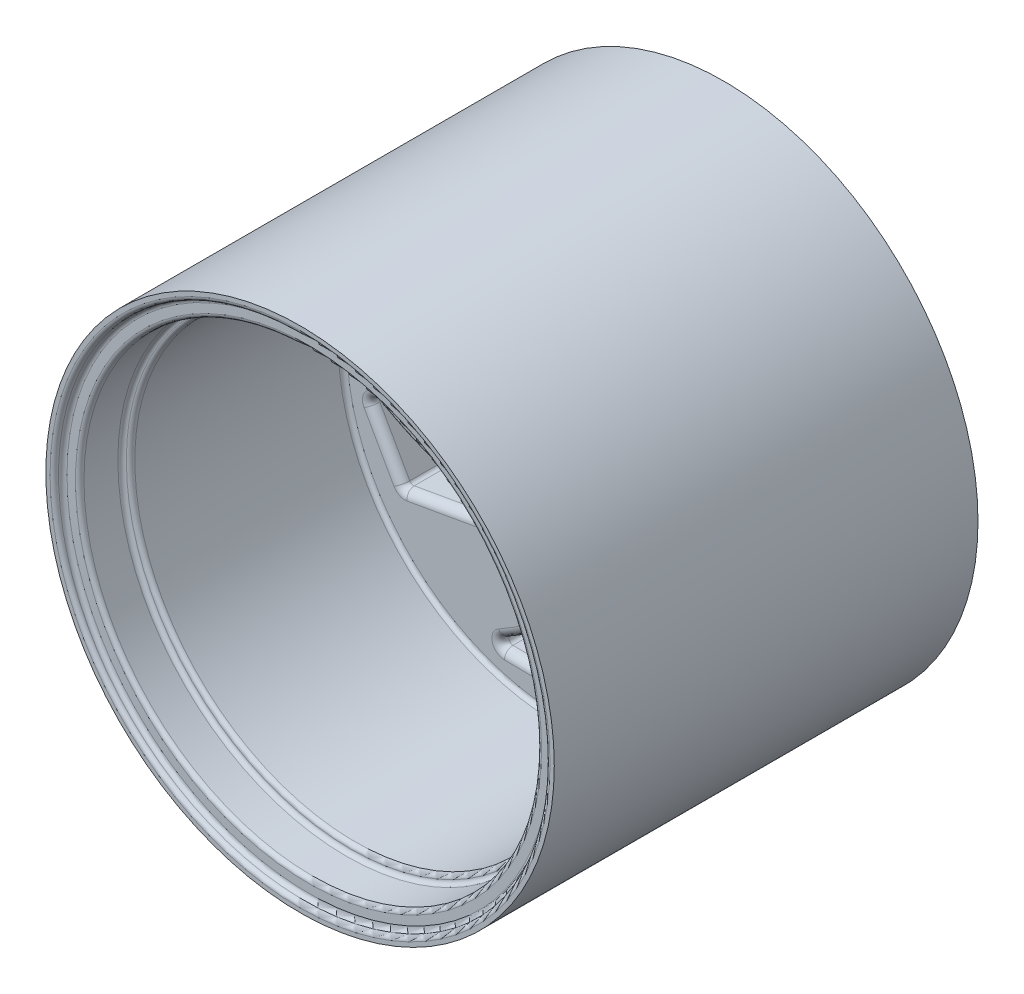
from build123d import *

# Parameters (mm, degrees)
IZIM1_R                     = 30
Y_KSEKLIK_EKSTR_ZYON1_DEPTH = 50
IZIM2_R                     = 29
KES_EKSTR_ZYON1_DEPTH       = 1
KES_EKSTR_ZYON2_START       = -1
IZIM3_R                     = 29
KES_EKSTR_ZYON2_DEPTH       = 1
IZIM4_R                     = 27
KES_EKSTR_ZYON3_DEPTH       = 5
IZIM5_R                     = 26
KES_EKSTR_ZYON4_DEPTH       = 25
IZIM6_R                     = 10
IZIM6_R_2                   = 8
IZIM6_R_3                   = 1
Y_KSEKLIK_EKSTR_ZYON2_DEPTH = 2
IZIM8_R                     = 2
KES_EKSTR_ZYON5_DEPTH       = 59.412250759
KES_EKSTR_ZYON6_DEPTH       = 59.412250759
IZIM12_R                    = 29
KES_EKSTR_ZYON7_DEPTH       = 10
Y_KSEKLIK_EKSTR_ZYON4_START = 10
Y_KSEKLIK_EKSTR_ZYON4_DEPTH = 10
RADYUS1_R                   = 0.5
RADYUS5_R                   = 0.5
RADYUS6_R                   = 1
RADYUS7_R                   = 0.5
SKETCH1_R                   = 2
BOSS_EXTRUDE1_DEPTH         = 2


# Some blends are built 0.0001 mm under size
with BuildPart() as part:
    # Çizim1 → Yükseklik-Ekstrüzyon1 (new body)
    with BuildSketch(Plane.XY):
        with Locations((-8.148787303, -1.554097453)):
            Circle(IZIM1_R)
    extrude(amount=Y_KSEKLIK_EKSTR_ZYON1_DEPTH)

    # Çizim2 → Kes-Ekstrüzyon1 (cut)
    with BuildSketch(Plane(origin=(0, 0, 0), x_dir=(-1, 0, 0), z_dir=(0, 0, -1))):
        with Locations((8.148787303, -1.554097453)):
            Circle(IZIM2_R)
    extrude(amount=-KES_EKSTR_ZYON1_DEPTH, mode=Mode.SUBTRACT)

    # Çizim3 → Kes-Ekstrüzyon2 (cut)
    with BuildSketch(Plane.XY.offset(50).offset(KES_EKSTR_ZYON2_START)):
        with Locations(Location((-8.148787303, -1.554097453, 0), (0, 0, 180))):
            Circle(IZIM3_R)
    extrude(amount=KES_EKSTR_ZYON2_DEPTH, mode=Mode.SUBTRACT)

    # Çizim4 → Kes-Ekstrüzyon3 (cut)
    with BuildSketch(Plane.XY.offset(49)):
        with Locations((-8.148787303, -1.554097453)):
            Circle(IZIM4_R)
    extrude(amount=-KES_EKSTR_ZYON3_DEPTH, mode=Mode.SUBTRACT)

    # Çizim5 → Kes-Ekstrüzyon4 (cut)
    with BuildSketch(Plane.XY.offset(44)):
        with Locations((-8.148787303, -1.554097453)):
            Circle(IZIM5_R)
    extrude(amount=-KES_EKSTR_ZYON4_DEPTH, mode=Mode.SUBTRACT)

    # Çizim6 → Yükseklik-Ekstrüzyon2 (add)
    # profile 1 of 9: a face of its own
    with BuildSketch(Plane.XY.offset(19)):
        with Locations((-8.148787303, -1.554097453)):
            Circle(IZIM6_R)
        with Locations((-8.148787303, -1.554097453)):
            Circle(IZIM6_R_2, mode=Mode.SUBTRACT)
    # profile 2 of 9: a face of its own
    with BuildSketch(Plane.XY.offset(19)):
        with Locations((-8.148787303, 4.445902547)):
            Circle(IZIM6_R_3)
    # profile 3 of 9: a face of its own
    with BuildSketch(Plane.XY.offset(19)):
        with Locations((-14.148787303, -1.554097453)):
            Circle(IZIM6_R_3)
    # profile 4 of 9: a face of its own
    with BuildSketch(Plane.XY.offset(19)):
        with Locations((-12.39142799, -5.79673814)):
            Circle(IZIM6_R_3)
    # profile 5 of 9: a face of its own
    with BuildSketch(Plane.XY.offset(19)):
        with Locations((-8.148787303, -7.554097453)):
            Circle(IZIM6_R_3)
    # profile 6 of 9: a face of its own
    with BuildSketch(Plane.XY.offset(19)):
        with Locations((-3.906146615, -5.79673814)):
            Circle(IZIM6_R_3)
    # profile 7 of 9: a face of its own
    with BuildSketch(Plane.XY.offset(19)):
        with Locations((-3.906146615, 2.688543234)):
            Circle(IZIM6_R_3)
    # profile 8 of 9: a face of its own
    with BuildSketch(Plane.XY.offset(19)):
        with Locations((-12.39142799, 2.688543234)):
            Circle(IZIM6_R_3)
    # profile 9 of 9: a face of its own
    with BuildSketch(Plane.XY.offset(19)):
        with Locations((-2.148787303, -1.554097453)):
            Circle(IZIM6_R_3)
    extrude(amount=Y_KSEKLIK_EKSTR_ZYON2_DEPTH)

    # Çizim8 → Kes-Ekstrüzyon5 (cut, through all)
    with BuildSketch(Plane.XY.offset(19)):
        with Locations((-8.148787303, -1.554097453)):
            Circle(IZIM8_R)
    extrude(amount=-KES_EKSTR_ZYON5_DEPTH, mode=Mode.SUBTRACT)

    # Çizim9 → Kes-Ekstrüzyon6 (cut, through all)
    with BuildSketch(Plane.XY.offset(19)):
        with BuildLine():
            Line((-13.925732405, 6.608433116), (-8.833557811, 20.638443128))
            Line((-8.833557811, 20.638443128), (0.723069615, 20.525490043))
            add(Edge.make_bspline(
                [(0.723069615, 20.525490043), (-8.727629056, 15.967451289), (-13.925732405, 6.608433116)],
                knots=[0, 0, 0, 1, 1, 1], degree=2))
        make_face()
        with BuildLine():
            Line((-3.968301022, 7.530149046), (10.72813136, 10.135201494))
            Line((10.72813136, 10.135201494), (15.408624833, 1.802442826))
            add(Edge.make_bspline(
                [(15.408624833, 1.802442826), (6.735898145, 7.707968582), (-3.968301022, 7.530149046)],
                knots=[0, 0, 0, 1, 1, 1], degree=2))
        make_face()
        with BuildLine():
            Line((1.80864408, -0.632381522), (11.412901869, -12.057339087))
            Line((11.412901869, -12.057339087), (6.536767916, -20.277144671))
            add(Edge.make_bspline(
                [(6.536767916, -20.277144671), (7.314739899, -9.813580161), (1.80864408, -0.632381522)],
                knots=[0, 0, 0, 1, 1, 1], degree=2))
        make_face()
        with BuildLine():
            Line((-2.3718422, -9.716628021), (-7.464016794, -23.746638033))
            Line((-7.464016794, -23.746638033), (-17.02064422, -23.633684949))
            add(Edge.make_bspline(
                [(-17.02064422, -23.633684949), (-7.569945549, -19.075646195), (-2.3718422, -9.716628021)],
                knots=[0, 0, 0, 1, 1, 1], degree=2))
        make_face()
        with BuildLine():
            Line((-12.329273583, -10.638343952), (-27.025705965, -13.243396399))
            Line((-27.025705965, -13.243396399), (-31.706199438, -4.910637732))
            add(Edge.make_bspline(
                [(-31.706199438, -4.910637732), (-23.03347275, -10.816163487), (-12.329273583, -10.638343952)],
                knots=[0, 0, 0, 1, 1, 1], degree=2))
        make_face()
        with BuildLine():
            Line((-18.106218685, -2.475813384), (-27.710476474, 8.949144181))
            Line((-27.710476474, 8.949144181), (-22.834342521, 17.168949765))
            add(Edge.make_bspline(
                [(-22.834342521, 17.168949765), (-23.612314504, 6.705385255), (-18.106218685, -2.475813384)],
                knots=[0, 0, 0, 1, 1, 1], degree=2))
        make_face()
    extrude(amount=-KES_EKSTR_ZYON6_DEPTH, mode=Mode.SUBTRACT)

    # Çizim12 → Kes-Ekstrüzyon7 (cut)
    with BuildSketch(Plane(origin=(0, 0, 1), x_dir=(-1, 0, 0), z_dir=(0, 0, -1))):
        with Locations((8.148787303, -1.554097453)):
            Circle(IZIM12_R)
    extrude(amount=-KES_EKSTR_ZYON7_DEPTH, mode=Mode.SUBTRACT)

    # Çizim13 → Yükseklik-Ekstrüzyon4 (add)
    with BuildSketch(Plane(origin=(0, 0, 11), x_dir=(-1, 0, 0), z_dir=(0, 0, -1)).offset(Y_KSEKLIK_EKSTR_ZYON4_START)):
        with BuildLine():
            Line((25.695028079, 21.53686796), (26.090507249, 21.230932957))
            Line((26.090507249, 21.230932957), (13.239027353, 4.617568143))
            ThreePointArc((13.239027353, 4.617568143), (15.55174657, 1.478425274), (16.105928887, -2.381078591))
            Line((16.105928887, -2.381078591), (36.919270337, -5.204105))
            Line((36.919270337, -5.204105), (36.852062437, -5.699567509))
            Line((36.852062437, -5.699567509), (16.038726518, -2.87654185))
            ThreePointArc((16.038726518, -2.87654185), (14.476508655, -6.448986878), (11.411171421, -8.858674776))
            Line((11.411171421, -8.858674776), (19.37302956, -28.295070413))
            Line((19.37302956, -28.295070413), (18.91034249, -28.484597919))
            Line((18.91034249, -28.484597919), (10.948486467, -9.048207446))
            ThreePointArc((10.948486467, -9.048207446), (7.073549388, -9.481509605), (3.454029836, -8.031693638))
            Line((3.454029836, -8.031693638), (-9.397453474, -24.645062866))
            Line((-9.397453474, -24.645062866), (-9.792932644, -24.339127863))
            Line((-9.792932644, -24.339127863), (3.058547252, -7.725763049))
            ThreePointArc((3.058547252, -7.725763049), (0.745828035, -4.58662018), (0.191645718, -0.727116315))
            Line((0.191645718, -0.727116315), (-20.621695731, 2.095910094))
            Line((-20.621695731, 2.095910094), (-20.554487832, 2.591372603))
            Line((-20.554487832, 2.591372603), (0.258848088, -0.231653055))
            ThreePointArc((0.258848088, -0.231653055), (1.82106595, 3.340791972), (4.886403184, 5.75047987))
            Line((4.886403184, 5.75047987), (-3.075454955, 25.186875507))
            Line((-3.075454955, 25.186875507), (-2.612767885, 25.376403013))
            Line((-2.612767885, 25.376403013), (5.349088138, 5.94001254))
            ThreePointArc((5.349088138, 5.94001254), (9.224025217, 6.373314699), (12.843544769, 4.923498732))
            Line((12.843544769, 4.923498732), (25.695028079, 21.53686796))
        make_face()
        Polygon((13.35894405, -5.185570983), (13.898814007, 1.142293883), (8.688657259, 4.773767413), (2.938630555, 2.077376077), (2.398760599, -4.250488789), (7.608917346, -7.881962319), align=None, mode=Mode.SUBTRACT)
    extrude(amount=-Y_KSEKLIK_EKSTR_ZYON4_DEPTH)

    # Radyus1
    radyus1_edges = [part.edges().sort_by_distance(p)[0] for p in [
        (20.851212697, -1.554097453, 49),
        (20.851212697, -1.554097453, 50),
        (-35.148787303, -1.554097453, 44),
        (-35.148787303, -1.554097453, 49),
        (-34.148787303, -1.554097453, 19),
        (-34.148787303, -1.554097453, 44),
    ]]
    fillet(radyus1_edges, radius=RADYUS1_R - 0.0001)  # a hair under: the kernel refuses the full size

    # Radyus5
    # the kernel refuses this fillet: 0.5 mm, written as the material it adds along each edge
    with BuildSketch(Plane(origin=(-22.834342521, 17.168949765, 19), x_dir=(-0.045917830144074794, -0.9989452201571715, 0), z_dir=(0, 0, -1)), Plane(origin=(-31.706199438, -4.910637732, 19), x_dir=(0.8421530225731109, -0.5392386174700152, 0), z_dir=(0, 0, -1)), Plane(origin=(-17.02064422, -23.633684949, 19), x_dir=(0.888070852717188, 0.459706602687156, 0), z_dir=(0, 0, -1)), Plane(origin=(6.536767916, -20.277144671, 19), x_dir=(0.045917830144079165, 0.9989452201571712, 0), z_dir=(0, 0, -1)), Plane(origin=(15.408624833, 1.802442826, 19), x_dir=(-0.8421530225731088, 0.5392386174700184, 0), z_dir=(0, 0, -1)), Plane(origin=(0.723069615, 20.525490043, 19), x_dir=(-0.8880708527171902, -0.45970660268715174, 0), z_dir=(0, 0, -1))) as radyus5_piece_1:
        with BuildLine():
            CenterArc((2.001629054, 0.499794242), RADYUS5_R, 118.04534383, 150.310869402)
            Line((1.766543964, 0.941082131), (1.761842262, 0.949907889))
            Line((1.761842262, 0.949907889), (-0.004701702, 0.008825758))
            Line((-0.004701702, 0.008825758), (0.000282763, -0.009996001))
            ThreePointArc((0.000282763, -0.009996001), (0.993642712, 0.00415476), (1.98699942, -0.009995885))
            Line((1.98699942, -0.009995885), (1.987286276, 0))
        make_face()
    extrude(amount=8)
    with BuildSketch(Plane(origin=(-18.106218685, -2.475813384, 19), x_dir=(-0.4605887665447725, 0.8876136480095184, 0), z_dir=(0, 0, -1)), Plane(origin=(-12.329273583, -10.638343952, 19), x_dir=(-0.998990351194408, 0.04492525147924159, 0), z_dir=(0, 0, -1)), Plane(origin=(-2.3718422, -9.716628021, 19), x_dir=(-0.5384015846496285, -0.8426883965302768, 0), z_dir=(0, 0, -1)), Plane(origin=(1.80864408, -0.632381522, 19), x_dir=(0.46058876654478326, -0.8876136480095126, 0), z_dir=(0, 0, -1)), Plane(origin=(-3.968301022, 7.530149046, 19), x_dir=(0.9989903511944087, -0.044925251479229544, 0), z_dir=(0, 0, -1)), Plane(origin=(-13.925732405, 6.608433116, 19), x_dir=(0.5384015846496182, 0.8426883965302833, 0), z_dir=(0, 0, -1))) as radyus5_piece_2:
        with BuildLine():
            CenterArc((4.514789372, -0.498983263), RADYUS5_R, 93.654521519, 163.718887163)
            Line((4.405491299, -0.986890971), (4.403305337, -0.996649125))
            Line((4.403305337, -0.996649125), (-0.002185961, -0.009758154))
            Line((-0.002185961, -0.009758154), (0.000615121, 0.009981063))
            ThreePointArc((0.000615121, 0.009981063), (2.241425805, -0.060297124), (4.482281874, 0.009979665))
            Line((4.482281874, 0.009979665), (4.482919275, 0))
        make_face()
    extrude(amount=8)
    with BuildSketch(Plane(origin=(-27.710476474, 8.949144181, 19), x_dir=(0.6434785417464973, -0.7654641508991792, 0), z_dir=(0, 0, -1)), Plane(origin=(-27.025705965, -13.243396399, 19), x_dir=(0.984650671238221, 0.17453668849305284, 0), z_dir=(0, 0, -1)), Plane(origin=(-7.464016794, -23.746638033, 19), x_dir=(0.34117212949171294, 0.9400008393922262, 0), z_dir=(0, 0, -1)), Plane(origin=(11.412901869, -12.057339087, 19), x_dir=(-0.6434785417465096, 0.7654641508991689, 0), z_dir=(0, 0, -1)), Plane(origin=(10.72813136, 10.135201494, 19), x_dir=(-0.9846506712382194, -0.17453668849306167, 0), z_dir=(0, 0, -1)), Plane(origin=(-8.833557811, 20.638443128, 19), x_dir=(-0.3411721294917053, -0.9400008393922289, 0), z_dir=(0, 0, -1))) as radyus5_piece_3:
        with BuildLine():
            CenterArc((RADYUS5_R * 0.70972912952, -RADYUS5_R), RADYUS5_R, 90, 70.728864475)
            Line((-RADYUS5_R * 0.234238208874, -RADYUS5_R * 0.669961117373), (-RADYUS5_R * 0.253117555642, -RADYUS5_R * 0.663360339721))
            Line((-RADYUS5_R * 0.253117555642, -RADYUS5_R * 0.663360339721), (-RADYUS5_R * 0.0141945825904, RADYUS5_R * 0.02))
            Line((-RADYUS5_R * 0.0141945825904, RADYUS5_R * 0.02), (RADYUS5_R * 0.70972912952, RADYUS5_R * 0.02))
            Line((RADYUS5_R * 0.70972912952, RADYUS5_R * 0.02), (RADYUS5_R * 0.70972912952, 0))
        make_face()
    extrude(amount=8)

    # Radyus6
    radyus6_edges = [part.edges().sort_by_distance(p)[0] for p in [
        (-25.692486189, 12.350914512, 19),
        (-22.298959889, 8.192351844, 19),
        (-24.246722562, 4.828759001, 19),
        (-23.664546284, -8.935281732, 19),
        (-21.725470771, -12.303890109, 19),
        (-28.962730347, -9.794880383, 19),
        (-11.419031461, -23.699892348, 19),
        (-9.514373698, -18.681731029, 19),
        (-5.627535511, -18.686746564, 19),
        (9.394911584, -15.459109418, 19),
        (6.001385284, -11.30054675, 19),
        (7.949147957, -7.936953907, 19),
        (7.366971679, 5.827086826, 19),
        (5.427896165, 9.195695204, 19),
        (12.665155742, 6.686685477, 19),
        (-4.878543145, 20.591697442, 19),
        (-6.783200908, 15.573536124, 19),
        (-10.670039095, 15.578551658, 19),
        (-23.289106196, 15.67341291, 19),
        (-20.364282606, 0.877314736, 19),
        (-27.597724453, 8.958388855, 19),
        (-16.362199677, -10.917320611, 19),
        (-26.977336077, -13.141127948, 19),
        (-30.638408368, -6.052243055, 19),
        (-15.498089474, -23.279753418, 19),
        (-4.146704373, -13.3487328, 19),
        (-7.528398927, -23.653614256, 19),
        (6.991531591, -18.781607816, 19),
        (4.066708001, -3.985509642, 19),
        (11.300149848, -12.066583761, 19),
        (0.064625072, 7.809125705, 19),
        (14.340833763, 2.944048149, 19),
        (10.679761472, 10.032933042, 19),
        (-0.799485131, 20.171558512, 19),
        (-12.150870232, 10.240537894, 19),
        (-8.769175678, 20.54541935, 19),
    ]]
    fillet(radyus6_edges, radius=RADYUS6_R)

    # Radyus7
    radyus7_edges = [part.edges().sort_by_distance(p)[0] for p in [
        (-18.148787303, -1.554097453, 19),
        (-16.148787303, -1.554097453, 19),
        (-16.148787303, -1.554097453, 21),
        (-18.148787303, -1.554097453, 21),
        (-9.148787303, 4.445902547, 19),
        (-9.148787303, 4.445902547, 21),
        (-15.148787303, -1.554097453, 19),
        (-15.148787303, -1.554097453, 21),
        (-13.39142799, -5.79673814, 19),
        (-13.39142799, -5.79673814, 21),
        (-9.148787303, -7.554097453, 19),
        (-9.148787303, -7.554097453, 21),
        (-4.906146615, -5.79673814, 19),
        (-4.906146615, -5.79673814, 21),
        (-4.906146615, 2.688543234, 19),
        (-4.906146615, 2.688543234, 21),
        (-13.39142799, 2.688543234, 19),
        (-13.39142799, 2.688543234, 21),
        (-3.148787303, -1.554097453, 19),
        (-3.148787303, -1.554097453, 21),
    ]]
    fillet(radyus7_edges, radius=RADYUS7_R - 0.0001)  # a hair under: the kernel refuses the full size

    # Sketch1 → Boss-Extrude1 (add)
    with BuildSketch(Plane(origin=(0, 0, 11), x_dir=(-1, 0, 0), z_dir=(0, 0, -1))):
        Polygon((8.688657259, 4.773767413), (2.938630555, 2.077376077), (2.398760599, -4.250488789), (7.608917346, -7.881962319), (13.35894405, -5.185570983), (13.898814007, 1.142293883), align=None)
        with Locations(Location((8.148787303, -1.554097453, 0), (0, 0, 180))):
            Circle(SKETCH1_R, mode=Mode.SUBTRACT)
    extrude(amount=BOSS_EXTRUDE1_DEPTH)


solid = part.part
